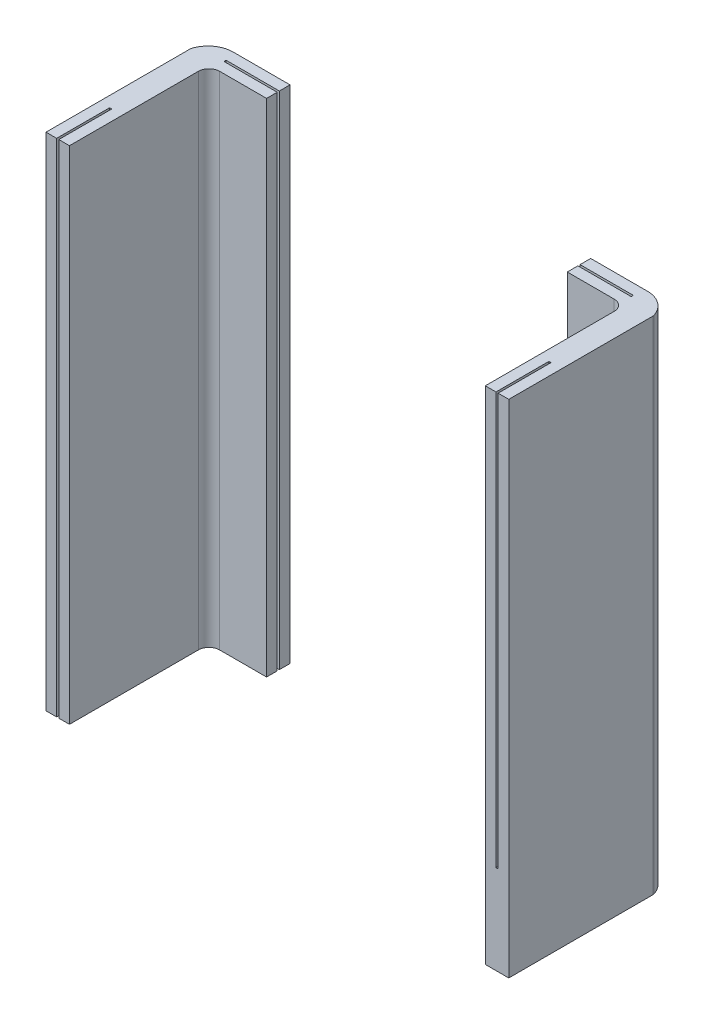
from build123d import *

# Parameters (mm, degrees)
BOSS_EXTRUDE1_DEPTH   = 470
BOSS_EXTRUDE1_2_DEPTH = 470
CAVITY1_START         = -201.389246797
CAVITY1_OUTLINE_W     = 2
CAVITY1_OUTLINE_H     = 49.622691928
CAVITY1_DEPTH         = 386.389246797


# Read off the part's stored shape, not the designer's step: Cavity1
with BuildPart() as part:
    # Sketch1 → Boss-Extrude1 (new body)
    with BuildSketch(Plane.XZ.offset(-185)):
        with BuildLine():
            Line((141, 0), (141, 10))
            Line((141, 10), (185, 10))
            ThreePointArc((185, 10), (192.071067812, 12.928932188), (195, 20))
            Line((195, 20), (195, 140.859811782))
            Line((195, 140.859811782), (217, 140.859811782))
            Line((217, 140.859811782), (217, 5.759608647))
            ThreePointArc((217, 5.759608647), (216.935858368, 4.961296569), (216.745079131, 4.183466508))
            ThreePointArc((216.745079131, 4.183466508), (208.456598854, -7.306668645), (195.087954648, -11.997240382))
            ThreePointArc((195.087954648, -11.997240382), (195.004917078, -11.999310048), (194.921856585, -12))
            Line((194.921856585, -12), (141, -12))
            Line((141, -12), (141, -2))
            Line((141, -2), (191, -2))
            Line((191, -2), (191, 0))
            Line((191, 0), (141, 0))
        make_face()
    extrude(amount=BOSS_EXTRUDE1_DEPTH)

    # Cavity1 outline → Cavity1 (cut)
    with BuildSketch(Plane(origin=(0, 0, 0), x_dir=(1, 0, 0), z_dir=(0, 1, 0)).offset(CAVITY1_START)):
        with Locations((206, -116.048465818)):
            Rectangle(CAVITY1_OUTLINE_W, CAVITY1_OUTLINE_H)
    extrude(amount=CAVITY1_DEPTH, mode=Mode.SUBTRACT)


with BuildPart() as body_2:
    # Sketch1 → Boss-Extrude1 2 (new body)
    with BuildSketch(Plane.XZ.offset(-185)):
        with BuildLine():
            Line((-141, 10), (-185, 10))
            ThreePointArc((-185, 10), (-192.071067812, 12.928932188), (-195, 20))
            Line((-195, 20), (-195, 140.859811782))
            Line((-195, 140.859811782), (-205, 140.859811782))
            Line((-205, 140.859811782), (-205, 91.237119854))
            Line((-205, 91.237119854), (-207, 91.237119854))
            Line((-207, 91.237119854), (-207, 140.859811782))
            Line((-207, 140.859811782), (-217, 140.859811782))
            Line((-217, 140.859811782), (-217, 5.759608647))
            ThreePointArc((-217, 5.759608647), (-216.935858368, 4.961296569), (-216.745079131, 4.183466508))
            ThreePointArc((-216.745079131, 4.183466508), (-208.456598854, -7.306668645), (-195.087954648, -11.997240382))
            ThreePointArc((-195.087954648, -11.997240382), (-195.004917078, -11.999310048), (-194.921856585, -12))
            Line((-194.921856585, -12), (-141, -12))
            Line((-141, -12), (-141, -2))
            Line((-141, -2), (-191, -2))
            Line((-191, -2), (-191, 0))
            Line((-191, 0), (-141, 0))
            Line((-141, 0), (-141, 10))
        make_face()
    extrude(amount=BOSS_EXTRUDE1_2_DEPTH)


solid = Compound([part.part, body_2.part])
